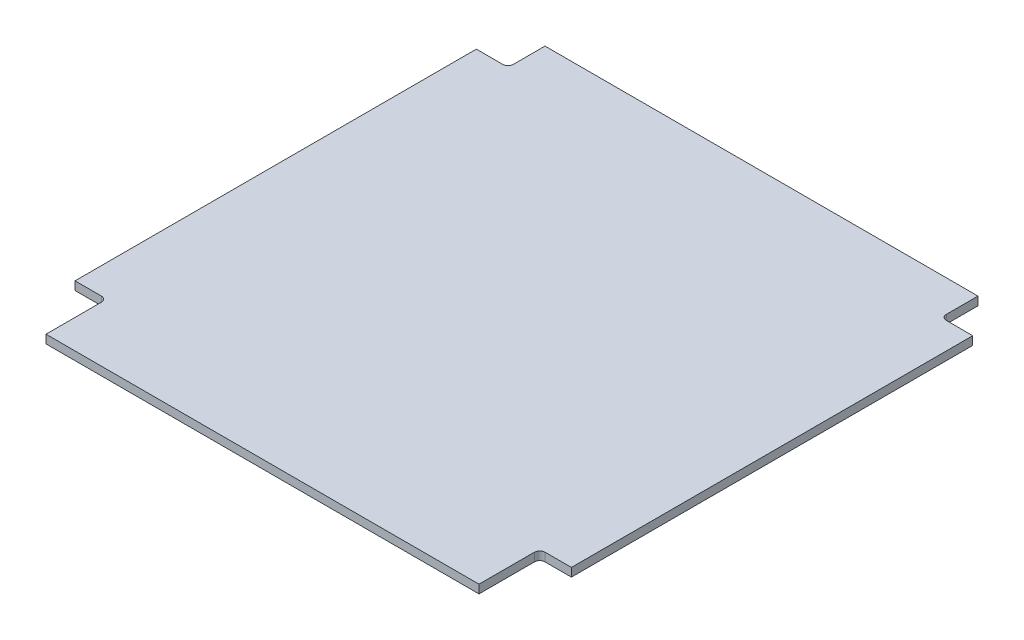
from build123d import *

# Parameters (mm, degrees)
BOSS_EXTRUDE1_DEPTH = 1.6
FILLET1_R           = 1


with BuildPart() as part:
    # Sketch1 → Boss-Extrude1 (new body)
    with BuildSketch(Plane(origin=(0, 0, 0), x_dir=(1, 0, 0), z_dir=(0, 1, 0))):
        Polygon((-41, 38), (-41, 45), (41, 45), (41, 38), (47, 38), (47, -38), (41, -38), (41, -49.5), (-41, -49.5), (-41, -38), (-47, -38), (-47, 38), align=None)
    extrude(amount=BOSS_EXTRUDE1_DEPTH)

    # Fillet1
    fillet1_edges = [part.edges().sort_by_distance(p)[0] for p in [
        (-41, 0.8, 38),
        (-41, 0.8, -38),
        (41, 0.8, -38),
        (41, 0.8, 38),
    ]]
    fillet(fillet1_edges, radius=FILLET1_R)


solid = part.part
